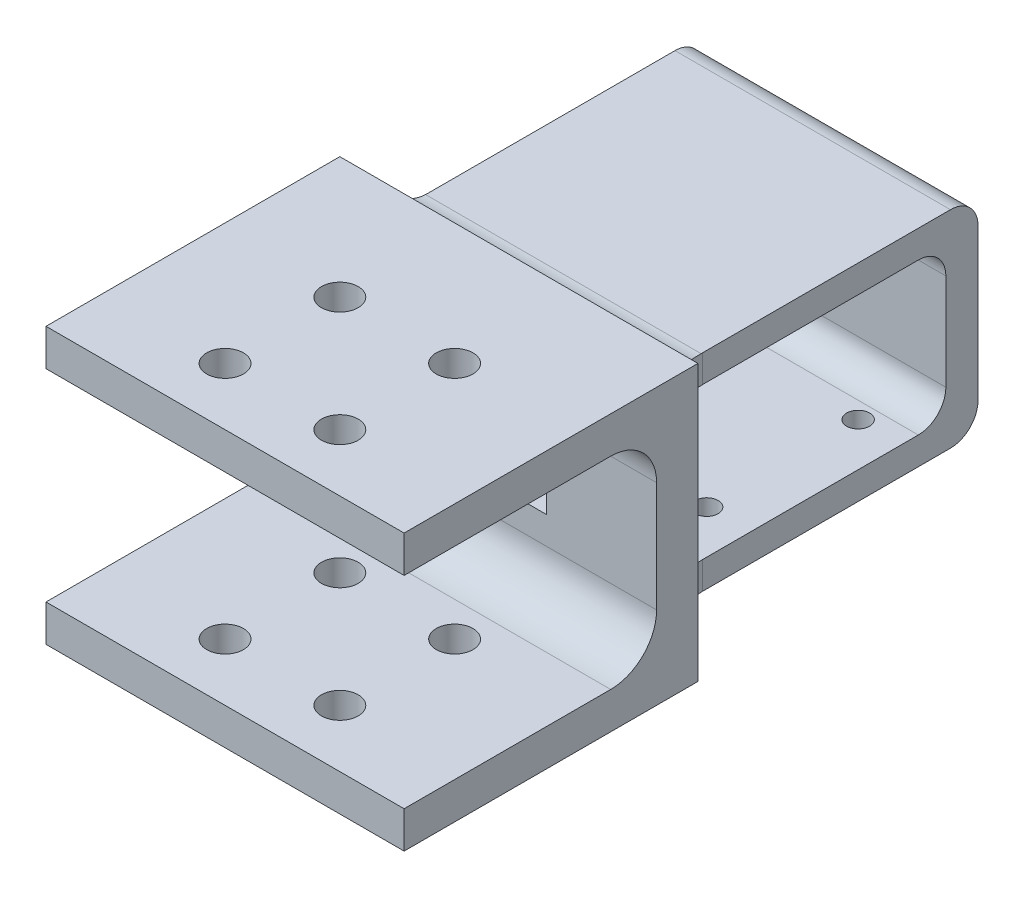
from build123d import *

# Parameters (mm, degrees)
BOSS_EXTRUDE1_DEPTH            = 40
CUT_EXTRUDE4_DEPTH             = 59.523499553598135
FILLET1_R                      = 4
BOSS_EXTRUDE2_DEPTH            = 8
BOSS_EXTRUDE2_DEPTH_BACK       = 10
SKETCH5_R                      = 1.100000000000001
SKETCH5_R_2                    = 1.099999999999999
BOSS_EXTRUDE3_DEPTH            = 2.5
FILLET4_R                      = 0.5
CUT_EXTRUDE5_DEPTH             = 2.5
CUT_EXTRUDE6_REACH             = 57.187
SKETCH7_W                      = 3.0000000000000018
SKETCH7_H                      = 4.5
CUT_EXTRUDE6_DIRECTION_2_REACH = 57.187
SKETCH10_W                     = 42.10000000000001
SKETCH10_H                     = 21.999999999999982
SKETCH10_W_2                   = 33.50000000000001
SKETCH10_H_2                   = 13.600000000000007
BOSS_EXTRUDE5_DEPTH            = 5
FILLET7_R                      = 10
BOSS_EXTRUDE6_DEPTH            = 20
CUT_EXTRUDE7_DEPTH             = 50.000000000000014
CUT_EXTRUDE8_DEPTH             = 1
CUT_EXTRUDE9_DEPTH             = 1
CUT_EXTRUDE10_DEPTH            = 92.39152039439985
SKETCH23_W                     = 3.0000000000000036
SKETCH23_H                     = 3.9999999999999982
SKETCH23_W_2                   = 3
SKETCH23_H_2                   = 3.9999999999999947
BOSS_EXTRUDE7_DEPTH            = 40
SKETCH24_W                     = 36.37597343518531
SKETCH24_H                     = 43.087119181285004
CUT_EXTRUDE13_DEPTH            = 15
SKETCH25_W                     = 34.94503589779944
SKETCH25_H                     = 44.200070599251774
CUT_EXTRUDE14_DEPTH            = 2
BOSS_EXTRUDE8_DEPTH            = 20
BOSS_EXTRUDE8_DEPTH_BACK       = 20
CUT_EXTRUDE15_DEPTH            = 110.35291491313801
SKETCH30_R                     = 1.1999999999999995
SKETCH30_R_2                   = 1.200000000000002
CUT_EXTRUDE16_DEPTH            = 5
SKETCH31_W                     = 19.999999999999993
SKETCH31_H                     = 4.999999999999993
CUT_EXTRUDE17_DEPTH            = 87.29982618754225
CUT_EXTRUDE18_DEPTH            = 76.1509148314244
CUT_EXTRUDE18_DEPTH_BACK       = 10
SKETCH32_R                     = 2
SKETCH35_W                     = 3.256593664037993
SKETCH35_H                     = 33.71989936187824
CUT_EXTRUDE19_DEPTH            = 90.66415114191405
SKETCH36_R                     = 2.0000000000000036
SKETCH36_R_2                   = 2.0000000000000018
BOSS_EXTRUDE9_DEPTH            = 30
SKETCH37_R                     = 2
CUT_EXTRUDE20_DEPTH            = 90.51765189056293
SKETCH38_W                     = 20.75
SKETCH38_H                     = 22.00000000000003
CUT_EXTRUDE21_DEPTH            = 86.51847753555955
SKETCH39_W                     = 72.23047350955149
SKETCH39_H                     = 70.43313668816296
CUT_EXTRUDE22_DEPTH            = 86.51847753555955
BOSS_EXTRUDE10_START           = -39
BOSS_EXTRUDE10_DEPTH           = 39
BOSS_EXTRUDE11_DEPTH           = 10
BOSS_EXTRUDE11_DEPTH_BACK      = 5
BOSS_EXTRUDE12_DEPTH           = 1
BOSS_EXTRUDE12_DEPTH_BACK      = 1
SKETCH42_R                     = 0.9999999999999996
SKETCH42_R_2                   = 1.0000000000000018
BOSS_EXTRUDE13_START           = -5
BOSS_EXTRUDE13_DEPTH           = 15
CUT_EXTRUDE23_DEPTH            = 52.244121614093466
BOSS_EXTRUDE15_START           = -0.5
BOSS_EXTRUDE15_DEPTH           = 2
SKETCH46_W                     = 15.000000000000005
SKETCH46_H                     = 10.749999999999996
BOSS_EXTRUDE16_DEPTH           = 1.45
BOSS_EXTRUDE17_DEPTH           = 1.45
SKETCH48_W                     = 36.4
SKETCH48_H                     = 40.100000000000016
CUT_EXTRUDE24_DEPTH            = 59.957357471311425
SKETCH49_W                     = 38.99999999999999
SKETCH49_H                     = 12.000000000000005
CUT_EXTRUDE25_DEPTH            = 41.709335538669755
BOSS_EXTRUDE18_DEPTH           = 12
BOSS_EXTRUDE19_DEPTH           = 35
SKETCH52_W                     = 3.4999999999999964
SKETCH52_H                     = 22.5
BOSS_EXTRUDE20_DEPTH           = 30
FILLET8_R                      = 3
FILLET9_R                      = 3
CUT_EXTRUDE26_DEPTH            = 4.5
FILLET10_R                     = 5
SKETCH54_R                     = 1.2499999999999973
SKETCH54_R_2                   = 1.2499999999999978
CUT_EXTRUDE27_DEPTH            = 3


with BuildPart() as part:
    # Sketch2 → Boss-Extrude1 (new body)
    with BuildSketch(Plane.XY):
        Polygon((-20.000000000000004, 15), (19.999999999999996, 15), (20.000000000000004, -15), (-20, -15), align=None)
    extrude(amount=BOSS_EXTRUDE1_DEPTH)

    # Sketch3 → Cut-Extrude4 (cut, through all)
    with BuildSketch(Plane.ZY.offset(20.000000000000004)):
        with BuildLine():
            Line((9.500000000000002, 11), (40, 11.000000000000005))
            Line((40, 11.000000000000005), (40, -10.999999999999995))
            Line((40, -10.999999999999995), (9.500000000000002, -11))
            ThreePointArc((9.500000000000002, -11), (5.964466094067265, -9.535533905932738), (4.500000000000003, -6.000000000000002))
            Line((4.500000000000003, -6.000000000000002), (4.500000000000003, 6.000000000000002))
            ThreePointArc((4.500000000000003, 6.000000000000002), (5.964466094067265, 9.535533905932738), (9.500000000000002, 11))
        make_face()
    extrude(amount=-CUT_EXTRUDE4_DEPTH, mode=Mode.SUBTRACT)

    # Fillet1
    fillet1_edges = [part.edges().sort_by_distance(p)[0] for p in [
        (3.55e-15, -15, 0),
        (-3.55e-15, 15, 0),
    ]]
    fillet(fillet1_edges, radius=FILLET1_R)

    # Sketch4 → Boss-Extrude2 (add, two sides: drawn at the far end of the back side and taken through both)
    with BuildSketch(Plane.ZY.offset(10.000000000000002).offset(-BOSS_EXTRUDE2_DEPTH_BACK)):
        Polygon((2.2e-16, 10.999999999999993), (-42.10000000000001, 10.999999999999982), (-42.10000000000001, -11.00000000000002), (1.4175884177630464, -11.000000000000005), (1.4175884177630464, 10.999999999999995), align=None)
        Polygon((-4.999999999999997, -6.099999999999999), (-37.1, -6.100000000000008), (-37.099999999999994, 6.099999999999992), (-4.999999999999999, 6.1), align=None, mode=Mode.SUBTRACT)
    extrude(amount=BOSS_EXTRUDE2_DEPTH + BOSS_EXTRUDE2_DEPTH_BACK)

    # Sketch5 → Boss-Extrude3 (add)
    # profile 1 of 2: a face of its own
    with BuildSketch(Plane(origin=(-2.5000000000000018, -3.9e-16, 0), x_dir=(0, 0, -1), z_dir=(1, 1.6e-16, 0))):
        Polygon((4.999999999999999, 6.1), (9.200000000000001, 6.1), (9.200000000000001, -6.1000000000000085), (4.999999999999999, -6.100000000000001), align=None)
        with Locations(Location((7.249999999999995, -5.23e-15, 0), (0, 0, 90))):
            Circle(SKETCH5_R, mode=Mode.SUBTRACT)
    # profile 2 of 2: a face of its own
    with BuildSketch(Plane(origin=(-2.5000000000000018, -3.9e-16, 0), x_dir=(0, 0, -1), z_dir=(1, 1.6e-16, 0))):
        Polygon((32.9, 6.1), (32.9, -6.1000000000000085), (37.1, -6.100000000000001), (37.1, 6.1), align=None)
        with Locations(Location((34.85, -1.85e-15, 0), (0, 0, 270))):
            Circle(SKETCH5_R_2, mode=Mode.SUBTRACT)
    extrude(amount=-BOSS_EXTRUDE3_DEPTH)

    # Fillet4
    fillet4_edges = [part.edges().sort_by_distance(p)[0] for p in [
        (-5.000000000000002, -1.68e-15, -37.1),
        (-5.000000000000002, -1.68e-15, -4.999999999999999),
    ]]
    fillet(fillet4_edges, radius=FILLET4_R)

    # Sketch6 → Cut-Extrude5 (cut)
    with BuildSketch(Plane(origin=(0, 0, 0), x_dir=(0, 0, -1), z_dir=(1, 1.6e-16, 0))):
        Polygon((37.8, -6.800000000000008), (37.79999999999999, 6.799999999999992), (4.299999999999999, 6.8), (4.299999999999997, -6.799999999999999), align=None)
    extrude(amount=-CUT_EXTRUDE5_DEPTH, mode=Mode.SUBTRACT)

    # Cut-Extrude6: up to this face of the body (flat: up to its plane)
    cut_extrude6_end = Plane(part.part.faces().sort_by_distance((0, 0, 4.5))[0])
    # Sketch7 → Cut-Extrude6 (cut, up to the picked face)
    with BuildSketch(Plane(origin=(0, 0, -9.200000000000001), x_dir=(-1, 0, 0), z_dir=(0, 0, -1)), mode=Mode.PRIVATE) as cut_extrude6_sk1:
        with Locations((13.5, 0)):
            Rectangle(SKETCH7_W, SKETCH7_H)
    cut_extrude6_tool1 = split(extrude(cut_extrude6_sk1.sketch, amount=-CUT_EXTRUDE6_REACH, mode=Mode.PRIVATE), bisect_by=cut_extrude6_end, keep=Keep.BOTH, mode=Mode.PRIVATE)
    add(cut_extrude6_tool1.solids().sort_by(Axis((-13.5, 0, -9.2), (0, 0, 1)))[0], mode=Mode.SUBTRACT)

    # Cut-Extrude6 direction 2: up to this face of the body (flat: up to its plane)
    cut_extrude6_direction_2_end = Plane(part.part.faces().sort_by_distance((-9, 0, -42.1))[0])
    # Sketch7 → Cut-Extrude6 direction 2 (cut, up to the picked face)
    with BuildSketch(Plane(origin=(0, 0, -9.200000000000001), x_dir=(-1, 0, 0), z_dir=(0, 0, -1)), mode=Mode.PRIVATE) as cut_extrude6_direction_2_sk1:
        with Locations((13.5, 0)):
            Rectangle(SKETCH7_W, SKETCH7_H)
    cut_extrude6_direction_2_tool1 = split(extrude(cut_extrude6_direction_2_sk1.sketch, amount=CUT_EXTRUDE6_DIRECTION_2_REACH, mode=Mode.PRIVATE), bisect_by=cut_extrude6_direction_2_end, keep=Keep.BOTH, mode=Mode.PRIVATE)
    add(cut_extrude6_direction_2_tool1.solids().sort_by(Axis((-13.5, 0, -9.2), (0, 0, -1)))[0], mode=Mode.SUBTRACT)

    # Sketch10 → Boss-Extrude5 (add)
    with BuildSketch(Plane(origin=(0, 0, 0), x_dir=(0, 0, -1), z_dir=(1, 1.6e-16, 0))):
        with Locations((21.050000000000004, -8.88e-15)):
            Rectangle(SKETCH10_W, SKETCH10_H)
        with Locations((21.05, -4.44e-15)):
            Rectangle(SKETCH10_W_2, SKETCH10_H_2, mode=Mode.SUBTRACT)
    extrude(amount=BOSS_EXTRUDE5_DEPTH)

    # Fillet7
    fillet7_edges = [part.edges().sort_by_distance(p)[0] for p in [
        (-6.5, 10.99999999999999, -2.2e-16),
        (-6.499999999999998, -11.000000000000002, -2.2e-16),
    ]]
    fillet(fillet7_edges, radius=FILLET7_R)

    # Sketch11 → Boss-Extrude6 (add)
    with BuildSketch(Plane(origin=(0, 0, -42.10000000000001), x_dir=(-1, 0, 0), z_dir=(0, 0, -1))):
        Polygon((1.999999999999995, 10.99999999999999), (-7.999999999999998, 10.99999999999999), (-7.999999999999991, -49.000000000000014), (2.0000000000000124, -49.000000000000014), (18.000000000000014, -49.000000000000014), (18.000000000000004, 10.999999999999979), align=None)
        Polygon((15, 2.25), (15, -2.25), (12, -2.25), (12, 2.2500000000000004), align=None, mode=Mode.SUBTRACT)
    extrude(amount=BOSS_EXTRUDE6_DEPTH)

    # Sketch14 → Cut-Extrude7 (cut)
    with BuildSketch(Plane(origin=(-1.27e-15, 10.999999999999993, -2.72e-15), x_dir=(1, 1.2e-16, 0), z_dir=(-1.2e-16, 1, -2.5e-16))):
        Polygon((1.9999999999999996, 55.1), (3.0000000000000004, 55.1), (3, 53.10000000000001), (13.000000000000002, 53.10000000000001), (13.000000000000002, 51.10000000000001), (3, 51.10000000000001), (3.0000000000000004, 49.1), (-0.9999999999999993, 49.1), (-1, 55.1), (0, 55.1), (-1.73e-15, 65.10000000000001), (1.9999999999999982, 65.10000000000001), align=None)
    extrude(amount=-CUT_EXTRUDE7_DEPTH, mode=Mode.SUBTRACT)

    # Sketch17 → Cut-Extrude8 (cut)
    with BuildSketch(Plane(origin=(0, -39.000000000000036, 0), x_dir=(1, 0, 0), z_dir=(0, 1, 0))):
        Polygon((-1.0000000000000013, 55.1), (2.9999999999999987, 55.1), (2.999999999999999, 49.1), (-1.0000000000000002, 49.1), align=None)
    extrude(amount=-CUT_EXTRUDE8_DEPTH, mode=Mode.SUBTRACT)

    # Sketch18 → Cut-Extrude9 (cut)
    with BuildSketch(Plane(origin=(-1.27e-15, 10.999999999999993, -2.72e-15), x_dir=(1, 1.2e-16, 0), z_dir=(-1.2e-16, 1, -2.5e-16))):
        Polygon((-17, 61.1), (6.999999999999999, 61.1), (6.999999999999999, 43.10000000000001), (-16.999999999999996, 43.10000000000001), align=None)
    extrude(amount=-CUT_EXTRUDE9_DEPTH, mode=Mode.SUBTRACT)

    # Sketch20 → Cut-Extrude10 (cut, through all)
    with BuildSketch(Plane(origin=(0, 15, 0), x_dir=(1, 0, 0), z_dir=(0, 1, 0))):
        Polygon((-23.277248853240756, -28.999999999999996), (21.563064344709886, -28.999999999999996), (21.563064344709886, -45.223630905791175), (-23.277248853240753, -45.223630905791175), align=None)
    extrude(amount=-CUT_EXTRUDE10_DEPTH, mode=Mode.SUBTRACT)

    # Sketch23 → Boss-Extrude7 (add)
    with BuildSketch(Plane.ZY.offset(20.000000000000004)):
        with Locations((30.5, 13.000000000000004)):
            Rectangle(SKETCH23_W, SKETCH23_H)
        with Locations((30.499999999999986, -13)):
            Rectangle(SKETCH23_W_2, SKETCH23_H_2)
    extrude(amount=-BOSS_EXTRUDE7_DEPTH)

    # Sketch24 → Cut-Extrude13 (cut)
    with BuildSketch(Plane(origin=(20, 4.63e-15, 0), x_dir=(0, 0, -1), z_dir=(1, 2.3e-16, 0))):
        with Locations((-18.187986717592654, 1.3612837109291025)):
            Rectangle(SKETCH24_W, SKETCH24_H)
    extrude(amount=-CUT_EXTRUDE13_DEPTH, mode=Mode.SUBTRACT)

    # Sketch25 → Cut-Extrude14 (cut)
    with BuildSketch(Plane.ZY.offset(20.000000000000004)):
        with Locations((17.47251794889972, 0.47340924827550346)):
            Rectangle(SKETCH25_W, SKETCH25_H)
    extrude(amount=-CUT_EXTRUDE14_DEPTH, mode=Mode.SUBTRACT)

    # Sketch26 → Boss-Extrude8 (add, two sides: drawn at the far end of the back side and taken through both)
    with BuildSketch(Plane.ZY.offset(6.500000000000001).offset(-BOSS_EXTRUDE8_DEPTH_BACK)):
        with BuildLine():
            Line((1.2005831511049319, 13.857142857142856), (1.2005831511049383, -13.857142857142856))
            ThreePointArc((1.2005831511049383, -13.857142857142856), (2.488142107963088, -14.703280399090202), (3.9999999999999956, -14.999999999999996))
            Line((3.9999999999999956, -14.999999999999996), (31.999999999999986, -14.999999999999996))
            Line((31.999999999999986, -14.999999999999996), (31.999999999999986, -10.999999999999998))
            Line((31.999999999999986, -10.999999999999998), (9.500000000000002, -10.999999999999998))
            ThreePointArc((9.500000000000002, -10.999999999999998), (5.964466094067264, -9.535533905932738), (4.5000000000000036, -6))
            Line((4.5000000000000036, -6), (4.500000000000003, 6.000000000000003))
            ThreePointArc((4.500000000000003, 6.000000000000003), (5.964466094067265, 9.535533905932738), (9.500000000000002, 11))
            Line((9.500000000000002, 11), (32, 11.000000000000005))
            Line((32, 11.000000000000005), (32, 15.000000000000007))
            Line((32, 15.000000000000007), (3.9999999999999964, 15.000000000000004))
            ThreePointArc((3.9999999999999964, 15.000000000000004), (2.4881421079630845, 14.703280399090207), (1.2005831511049319, 13.857142857142856))
        make_face()
    extrude(amount=BOSS_EXTRUDE8_DEPTH + BOSS_EXTRUDE8_DEPTH_BACK)

    # Sketch27 → Cut-Extrude15 (cut, through all)
    with BuildSketch(Plane(origin=(0, 0, -62.1), x_dir=(-1, 0, 0), z_dir=(0, 0, -1))):
        Polygon((12, -2.2500000000000004), (15, -2.25), (15, 2.25), (12, 2.25), align=None)
    extrude(amount=-CUT_EXTRUDE15_DEPTH, mode=Mode.SUBTRACT)

    # Sketch30 → Cut-Extrude16 (cut)
    with BuildSketch(Plane(origin=(-7.2e-16, 9.999999999999995, -2.89e-15), x_dir=(1, 7e-17, 0), z_dir=(-7e-17, 1, -2.9e-16))):
        with Locations(Location((4.999999999999999, 58.1, 0), (0, 0, 270))):
            Circle(SKETCH30_R)
        with Locations(Location((4.999999999999999, 46.100000000000016, 0), (0, 0, 90))):
            Circle(SKETCH30_R)
        with Locations(Location((-14.999999999999998, 58.1, 0), (0, 0, 90))):
            Circle(SKETCH30_R_2)
        with Locations(Location((-14.999999999999998, 46.100000000000016, 0), (0, 0, 270))):
            Circle(SKETCH30_R_2)
    extrude(amount=-CUT_EXTRUDE16_DEPTH, mode=Mode.SUBTRACT)

    # Sketch31 → Cut-Extrude17 (cut, through all)
    with BuildSketch(Plane(origin=(7.9999999999999964, -9.3e-16, 0), x_dir=(0, 0, -1), z_dir=(1, -1.2e-16, 0))):
        with Locations((52.10000000000001, -46.500000000000014)):
            Rectangle(SKETCH31_W, SKETCH31_H)
    extrude(amount=-CUT_EXTRUDE17_DEPTH, mode=Mode.SUBTRACT)

    # Sketch32 → Cut-Extrude18 (cut, two sides: drawn at the far end of the back side and taken through both)
    with BuildSketch(Plane(origin=(1.27e-15, -11, 1.88e-15), x_dir=(1, 1.2e-16, 0), z_dir=(-1.2e-16, 1, -1.7e-16)).offset(-CUT_EXTRUDE18_DEPTH_BACK)):
        with Locations(Location((-16.5, -26.37499999999999, 0), (0, 0, 90))):
            Circle(SKETCH32_R)
        with Locations(Location((-16.500000000000004, -15.124999999999996, 0), (0, 0, 90))):
            Circle(SKETCH32_R)
        with Locations(Location((3.4999999999999996, -26.37499999999999, 0), (0, 0, 90))):
            Circle(SKETCH32_R)
        with Locations(Location((3.500000000000003, -15.124999999999996, 0), (0, 0, 90))):
            Circle(SKETCH32_R)
    extrude(amount=CUT_EXTRUDE18_DEPTH + CUT_EXTRUDE18_DEPTH_BACK, mode=Mode.SUBTRACT)

    # Sketch35 → Cut-Extrude19 (cut, through all)
    with BuildSketch(Plane(origin=(0, 15, 0), x_dir=(1, 0, 0), z_dir=(0, 1, 0))):
        with Locations((14.628296832018993, -16.85994968093912)):
            Rectangle(SKETCH35_W, SKETCH35_H)
        with Locations((-27.628296832019, -16.85994968093912)):
            Rectangle(SKETCH35_W, SKETCH35_H)
    extrude(amount=-CUT_EXTRUDE19_DEPTH, mode=Mode.SUBTRACT)

    # Sketch36 → Boss-Extrude9 (add)
    with BuildSketch(Plane(origin=(0, 15, 0), x_dir=(1, 0, 0), z_dir=(0, 1, 0))):
        with Locations(Location((-16.500000000000007, -15.124999999999993, 0), (0, 0, 270))):
            Circle(SKETCH36_R)
        with Locations(Location((3.5000000000000013, -15.124999999999993, 0), (0, 0, 270))):
            Circle(SKETCH36_R)
        with Locations(Location((3.499999999999998, -26.37499999999999, 0), (0, 0, 270))):
            Circle(SKETCH36_R)
        with Locations(Location((-16.500000000000004, -26.37499999999999, 0), (0, 0, 270))):
            Circle(SKETCH36_R_2)
    extrude(amount=-BOSS_EXTRUDE9_DEPTH)

    # Sketch37 → Cut-Extrude20 (cut, through all)
    with BuildSketch(Plane(origin=(0, 15, 0), x_dir=(1, 0, 0), z_dir=(0, 1, 0))):
        with Locations(Location((-12.750000000000002, -25.750000000000004, 0), (0, 0, 270))):
            Circle(SKETCH37_R)
        with Locations(Location((-0.25000000000000194, -25.750000000000004, 0), (0, 0, 270))):
            Circle(SKETCH37_R)
        with Locations(Location((-0.25000000000000194, -13.249999999999998, 0), (0, 0, 270))):
            Circle(SKETCH37_R)
        with Locations(Location((-12.750000000000002, -13.249999999999998, 0), (0, 0, 270))):
            Circle(SKETCH37_R)
    extrude(amount=-CUT_EXTRUDE20_DEPTH, mode=Mode.SUBTRACT)

    # Sketch38 → Cut-Extrude21 (cut, through all)
    with BuildSketch(Plane(origin=(12.999999999999995, 0, 0), x_dir=(0, 0, -1), z_dir=(1, 0, 0))):
        with Locations((-21.625, -7.99e-15)):
            Rectangle(SKETCH38_W, SKETCH38_H)
    extrude(amount=-CUT_EXTRUDE21_DEPTH, mode=Mode.SUBTRACT)

    # Sketch39 → Cut-Extrude22 (cut, through all)
    with BuildSketch(Plane(origin=(12.999999999999995, 0, 0), x_dir=(0, 0, -1), z_dir=(1, 0, 0))):
        with Locations((33.86442471014106, -15.892395865001207)):
            Rectangle(SKETCH39_W, SKETCH39_H)
    extrude(amount=-CUT_EXTRUDE22_DEPTH, mode=Mode.SUBTRACT)

    # Sketch40 → Boss-Extrude10 (add)
    with BuildSketch(Plane(origin=(12.999999999999995, 0, 0), x_dir=(0, 0, -1), z_dir=(1, 0, 0)).offset(BOSS_EXTRUDE10_START)):
        Polygon((-3.9999999999999964, 15), (0, 15), (3.69e-15, -14.999999999999998), (-3.9999999999999964, -15), align=None)
    extrude(amount=BOSS_EXTRUDE10_DEPTH)

    # Sketch41 → Boss-Extrude11 (add, two sides: drawn at the far end of the back side and taken through both)
    with BuildSketch(Plane.ZY.offset(6.500000000000003).offset(-BOSS_EXTRUDE11_DEPTH_BACK)):
        Polygon((-21.400000000000002, 15), (-3.000000000000001, 15), (0, 15), (1.5470726612208523, 15), (1.5470726612208523, -14.999999999999998), (-3.69e-15, -14.999999999999998), (-2.999999999999997, -15), (-2.9999999999999956, -23.60000000000001), (-21.4, -23.60000000000001), align=None)
        Polygon((-18.400000000000006, 12), (-6.000000000000002, 12), (-5.999999999999996, -20.600000000000012), (-18.399999999999995, -20.600000000000016), align=None, mode=Mode.SUBTRACT)
    extrude(amount=BOSS_EXTRUDE11_DEPTH + BOSS_EXTRUDE11_DEPTH_BACK)

    # Sketch42 → Boss-Extrude12 (add, two sides: drawn at the far end of the back side and taken through both)
    # profile 1 of 2: a face of its own
    with BuildSketch(Plane.ZY.offset(6.500000000000003).offset(-BOSS_EXTRUDE12_DEPTH_BACK)):
        Polygon((-18.400000000000006, 12), (-6.000000000000001, 12), (-5.999999999999996, 8), (-18.400000000000006, 8), align=None)
        with Locations((-12.200000000000005, 9.499999999999998)):
            Circle(SKETCH42_R, mode=Mode.SUBTRACT)
    # profile 2 of 2: a face of its own
    with BuildSketch(Plane.ZY.offset(6.500000000000003).offset(-BOSS_EXTRUDE12_DEPTH_BACK)):
        Polygon((-5.99999999999999, -20.600000000000012), (-5.9999999999999885, -16.600000000000012), (-18.4, -16.60000000000002), (-18.399999999999995, -20.60000000000002), align=None)
        with Locations(Location((-12.199999999999998, -18.100000000000012, 0), (0, 0, 180))):
            Circle(SKETCH42_R_2, mode=Mode.SUBTRACT)
    extrude(amount=BOSS_EXTRUDE12_DEPTH + BOSS_EXTRUDE12_DEPTH_BACK)

    # Sketch43 → Boss-Extrude13 (add)
    with BuildSketch(Plane.ZY.offset(6.500000000000003).offset(BOSS_EXTRUDE13_START)):
        Polygon((-21.4, -23.60000000000001), (-36.4, -23.600000000000012), (-36.4, 1.3999999999999881), (-21.4, 1.3999999999999924), align=None)
    extrude(amount=BOSS_EXTRUDE13_DEPTH)

    # Sketch44 → Cut-Extrude23 (cut, through all)
    with BuildSketch(Plane(origin=(0, 1.3999999999999986, -4e-16), x_dir=(1, 0, 0), z_dir=(0, 1, -2.9e-16))):
        Polygon((-11.000000000000002, 33.9), (-10.05161980261447, 33.9), (-10.05161980261447, 38.21704707254863), (-7.988963640274769, 38.21704707254863), (-7.988963640274769, 33.9), (-7.000000000000001, 33.9), (-7.000000000000001, 31.9), (0.8667068167036787, 31.9), (0.8667068167036787, 29.900000000000006), (-7.000000000000001, 29.900000000000006), (-6.999999999999999, 27.900000000000002), (-11.000000000000002, 27.900000000000002), (-11.000000000000007, 29.900000000000002), (-18.866706816703683, 29.900000000000002), (-18.866706816703683, 31.89999999999999), (-11.000000000000007, 31.9), align=None)
    extrude(amount=-CUT_EXTRUDE23_DEPTH, mode=Mode.SUBTRACT)


with BuildPart() as cut_extrude23_piece_1:
    # of the separate pieces the step leaves, piece 1, a body of its own (cut_extrude23_pieces)
    add(part.part.solids().sort_by_distance((13, 15, 0))[0])



with BuildPart() as cut_extrude23_piece_2:
    # of the separate pieces the step leaves, piece 2, a body of its own (cut_extrude23_pieces)
    add(part.part.solids().sort_by_distance((-1.5, 1.4, -36.4))[0])


with BuildPart() as cut_extrude23_piece_3:
    # of the separate pieces the step leaves, piece 3, a body of its own (cut_extrude23_pieces)
    add(part.part.solids().sort_by_distance((-16.5, 1.4, -36.4))[0])


with BuildPart() as cut_extrude23_piece_1_1:
    add(cut_extrude23_piece_1.part)

    add(cut_extrude23_piece_2.part)  # Boss-Extrude15 merges Cut-Extrude23 piece 2

    add(cut_extrude23_piece_3.part)  # Boss-Extrude15 merges Cut-Extrude23 piece 3
    # Sketch45 → Boss-Extrude15 (add)
    with BuildSketch(Plane(origin=(0, 1.3999999999999986, -4e-16), x_dir=(1, 0, 0), z_dir=(0, 1, -2.9e-16)).offset(BOSS_EXTRUDE15_START)):
        Polygon((-11.000000000000002, 33.9), (-10.05161980261447, 33.9), (-9.851619802614469, 33.9), (-9.851619802614469, 36.4), (-8.18896364027477, 36.4), (-8.18896364027477, 33.9), (-7.988963640274769, 33.9), (-6.999999999999999, 33.9), (-7.000000000000001, 31.9), (-7.000000000000001, 31.7), (-1.5000000000000013, 31.7), (-1.5000000000000013, 30.100000000000005), (-7.000000000000003, 30.100000000000005), (-7.000000000000003, 29.900000000000006), (-6.999999999999999, 27.900000000000002), (-11.000000000000002, 27.900000000000002), (-11.000000000000007, 29.900000000000002), (-11.000000000000007, 30.1), (-16.50000000000001, 30.1), (-16.500000000000007, 31.7), (-11.000000000000007, 31.7), (-11.000000000000007, 31.9), align=None)
    boss_extrude15 = extrude(amount=BOSS_EXTRUDE15_DEPTH)

    # Sketch46 → Boss-Extrude16 (add)
    with BuildSketch(Plane(origin=(0, 2.8999999999999964, -6.3e-16), x_dir=(1, 0, 0), z_dir=(0, 1, -2.2e-16))):
        with Locations((-9.000000000000004, 31.025)):
            Rectangle(SKETCH46_W, SKETCH46_H)
    extrude(amount=-BOSS_EXTRUDE16_DEPTH)

    # Mirror1: Boss-Extrude15 across plane
    add(boss_extrude15.mirror(Plane.ZX.offset(-11.100000000000005)))

    # Sketch47 → Boss-Extrude17 (add)
    with BuildSketch(Plane.XZ.offset(25.10000000000001)):
        Polygon((-1.5000000000000013, -36.4), (-16.5, -36.4), (-16.5, -25.650000000000002), (-1.5000000000000013, -25.65), align=None)
    extrude(amount=-BOSS_EXTRUDE17_DEPTH)

    # Sketch48 → Cut-Extrude24 (cut, through all)
    with BuildSketch(Plane(origin=(12.999999999999995, 0, 0), x_dir=(0, 0, -1), z_dir=(1, 0, 0))):
        with Locations((18.2, -5.050000000000005)):
            Rectangle(SKETCH48_W, SKETCH48_H)
    extrude(amount=-CUT_EXTRUDE24_DEPTH, mode=Mode.SUBTRACT)

    # Sketch49 → Cut-Extrude25 (cut, through all)
    with BuildSketch(Plane.XY.offset(4.500000000000003)):
        with Locations((-6.5, 2.66e-15)):
            Rectangle(SKETCH49_W, SKETCH49_H)
    extrude(amount=-CUT_EXTRUDE25_DEPTH, mode=Mode.SUBTRACT)


with BuildPart() as cut_extrude25_piece_1:
    # of the separate pieces the step leaves, piece 1, a body of its own (cut_extrude25_pieces)
    add(cut_extrude23_piece_1_1.part.solids().sort_by_distance((13, 15, 0))[0])



with BuildPart() as cut_extrude25_piece_2:
    # of the separate pieces the step leaves, piece 2, a body of its own (cut_extrude25_pieces)
    add(cut_extrude23_piece_1_1.part.solids().sort_by_distance((13, -6, 0))[0])


with BuildPart() as cut_extrude25_piece_1_1:
    add(cut_extrude25_piece_1.part)

    add(cut_extrude25_piece_2.part)  # Boss-Extrude18 merges Cut-Extrude25 piece 2
    # Sketch50 → Boss-Extrude18 (add)
    with BuildSketch(Plane(origin=(0, -6.000000000000001, 0), x_dir=(1, 0, 0), z_dir=(0, 1, 0))):
        Polygon((-25.999999999999996, -4.500000000000003), (12.999999999999995, -4.5000000000000036), (12.999999999999995, 3.47e-15), (-25.999999999999996, 3.47e-15), align=None)
    extrude(amount=BOSS_EXTRUDE18_DEPTH)

    # Sketch51 → Boss-Extrude19 (add)
    with BuildSketch(Plane(origin=(0, 0, 0), x_dir=(-1, 0, 0), z_dir=(0, 1.2e-16, -1))):
        Polygon((-8.5, 8.25), (21.5, 8.25), (21.500000000000004, 11.250000000000005), (-8.499999999999996, 11.250000000000005), align=None)
        Polygon((-8.499999999999993, -11.249999999999995), (21.50000000000001, -11.249999999999995), (21.5, -8.25), (-8.5, -8.25), align=None)
    extrude(amount=BOSS_EXTRUDE19_DEPTH)

    # Sketch52 → Boss-Extrude20 (add)
    with BuildSketch(Plane(origin=(8.500000000000009, 9.83e-15, 0), x_dir=(0, 0, -1), z_dir=(1, 1.16e-15, 0))):
        with Locations((33.25, -1.78e-15)):
            Rectangle(SKETCH52_W, SKETCH52_H)
    extrude(amount=-BOSS_EXTRUDE20_DEPTH)

    # Fillet8
    fillet8_edges = [cut_extrude25_piece_1_1.edges().sort_by_distance(p)[0] for p in [
        (-6.500000000000009, -11.249999999999991, -35),
        (-6.5000000000000036, 11.250000000000009, -35),
    ]]
    fillet(fillet8_edges, radius=FILLET8_R)

    # Fillet9
    fillet9_edges = [cut_extrude25_piece_1_1.edges().sort_by_distance(p)[0] for p in [
        (-6.499999999999993, -8.249999999999996, -31.5),
        (-6.500000000000002, 8.250000000000004, -31.5),
    ]]
    fillet(fillet9_edges, radius=FILLET9_R)

    # Sketch53 → Cut-Extrude26 (cut)
    with BuildSketch(Plane.XY.offset(4.5000000000000036)):
        Polygon((-13.999999999999998, 3.0000000000000053), (1, 3.0000000000000053), (1.0000000000000004, -2.9999999999999947), (-13.999999999999996, -2.9999999999999947), align=None)
    extrude(amount=-CUT_EXTRUDE26_DEPTH, mode=Mode.SUBTRACT)

    # Fillet10
    # the kernel refuses this fillet: 5 mm, written as the material it adds along each edge
    with BuildSketch(Plane(origin=(-21.50000000000001, -11.249999999999995, -1.38e-15), x_dir=(-1, 3.55e-15, -4.8e-16), z_dir=(3.55e-15, 1, 1.2e-16))) as fillet10_piece_1:
        with BuildLine():
            CenterArc((4.999999999999971, -4.9749371855331015), FILLET10_R, 95.73917047726648, 84.26082952273356)
            Line((-2.958e-14, -4.974937185533104), (-0.100000000000031, -4.974937185533104))
            Line((-0.100000000000031, -4.974937185533104), (-0.10000000000000142, -5e-17))
            Line((-0.10000000000000142, -5e-17), (-5e-17, 0.1))
            ThreePointArc((-5e-17, 0.1), (2.2499999999999964, 0.09999999999999926), (4.489999999999998, 0.09949874371066206))
            Line((4.489999999999998, 0.09949874371066206), (4.4999999999999964, 0))
        make_face()
    extrude(amount=2.9999999999999947)
    with BuildSketch(Plane(origin=(8.5, -8.25, -1.01e-15), x_dir=(3.93e-15, 1.2e-16, -1), z_dir=(-2.37e-15, -1, -1.2e-16))) as fillet10_piece_2:
        with BuildLine():
            CenterArc((4.974937185533118, 5), FILLET10_R, 185.73917047726684, 84.26082952273293)
            Line((1.933e-14, 4.499999999999995), (-0.09949874371064266, 4.489999999999995))
            ThreePointArc((-0.09949874371064266, 4.489999999999995), (-0.09999999999998932, 2.2499999999999933), (-0.1, 3.9e-16))
            Line((-0.1, 3.9e-16), (-3.9e-16, -0.09999999999999964))
            Line((-3.9e-16, -0.09999999999999964), (4.974937185533099, -0.09999999999999964))
            Line((4.974937185533099, -0.09999999999999964), (4.974937185533099, 0))
        make_face()
    extrude(amount=2.9999999999999947)
    with BuildSketch(Plane(origin=(8.499999999999993, -11.249999999999995, -1.38e-15), x_dir=(0, -1, -5.8e-16), z_dir=(-1, 0, 0))) as fillet10_piece_3:
        with BuildLine():
            CenterArc((5.000000000000001, -4.841229182759271), FILLET10_R, 104.4775121859299, 75.52248781407013)
            Line((1.03e-15, -4.841229182759273), (-0.09999999999999862, -4.841229182759273))
            Line((-0.09999999999999862, -4.841229182759273), (-0.09999999999999964, -5e-17))
            Line((-0.09999999999999964, -5e-17), (-6e-17, 0.1))
            ThreePointArc((-6e-17, 0.1), (1.8750000000000018, 0.09999999999999902), (3.725000000000003, 0.09682458365518543))
            Line((3.725000000000003, 0.09682458365518543), (3.7500000000000036, 0))
        make_face()
    extrude(amount=30.000000000000004)
    with BuildSketch(Plane(origin=(8.499999999999996, 11.250000000000005, 1.38e-15), x_dir=(0, 1.2e-16, -1), z_dir=(1.18e-15, -1, -1.2e-16))) as fillet10_piece_4:
        with BuildLine():
            CenterArc((4.974937185533102, 5), FILLET10_R, 185.7391704772668, 84.26082952273316)
            Line((2.27e-15, 4.499999999999998), (-0.09949874371065973, 4.489999999999998))
            ThreePointArc((-0.09949874371065973, 4.489999999999998), (-0.09999999999999816, 2.2499999999999964), (-0.1, 0))
            Line((-0.1, 0), (0, -0.09999999999999964))
            Line((0, -0.09999999999999964), (4.974937185533102, -0.09999999999999964))
            Line((4.974937185533102, -0.09999999999999964), (4.974937185533102, 0))
        make_face()
    extrude(amount=3.0000000000000053)
    with BuildSketch(Plane(origin=(-21.5, 8.25, 1.01e-15), x_dir=(-1, -1.18e-15, -4.2e-16), z_dir=(-1.18e-15, 1, 1.2e-16))) as fillet10_piece_5:
        with BuildLine():
            CenterArc((5.000000000000002, -4.974937185533101), FILLET10_R, 95.73917047726673, 84.26082952273327)
            Line((2.1e-15, -4.974937185533102), (-0.09999999999999931, -4.974937185533102))
            Line((-0.09999999999999931, -4.974937185533102), (-0.10000000000000142, -4e-17))
            Line((-0.10000000000000142, -4e-17), (-4e-17, 0.1))
            ThreePointArc((-4e-17, 0.1), (2.2500000000000036, 0.09999999999999912), (4.4900000000000055, 0.09949874371066202))
            Line((4.4900000000000055, 0.09949874371066202), (4.500000000000007, 0))
        make_face()
    extrude(amount=3.0000000000000053)
    with BuildSketch(Plane(origin=(-21.500000000000004, 11.250000000000005, 1.38e-15), x_dir=(0, 1, -3.7e-16), z_dir=(1, 0, 0))) as fillet10_piece_6:
        with BuildLine():
            CenterArc((5.0000000000000036, -4.841229182759269), FILLET10_R, 104.47751218593004, 75.52248781407002)
            Line((3.56e-15, -4.841229182759272), (-0.09999999999999608, -4.841229182759272))
            Line((-0.09999999999999608, -4.841229182759272), (-0.09999999999999964, -5e-17))
            Line((-0.09999999999999964, -5e-17), (-4e-17, 0.1))
            ThreePointArc((-4e-17, 0.1), (1.8749999999999982, 0.09999999999999908), (3.7249999999999943, 0.09682458365518537))
            Line((3.7249999999999943, 0.09682458365518537), (3.7499999999999947, 0))
        make_face()
    extrude(amount=30)
    with BuildSketch(Plane(origin=(8.499999999999993, -11.249999999999995, -1.38e-15), x_dir=(0, -1, -5.8e-16), z_dir=(-1, 0, 0))) as fillet10_piece_7a_section:
        with BuildLine():
            CenterArc((5.000000000000001, -4.841229182759271), FILLET10_R, 104.4775121859299, 75.52248781407013)
            Line((1.03e-15, -4.841229182759273), (-0.09999999999999862, -4.841229182759273))
            Line((-0.09999999999999862, -4.841229182759273), (-0.09999999999999964, -5e-17))
            Line((-0.09999999999999964, -5e-17), (-6e-17, 0.1))
            ThreePointArc((-6e-17, 0.1), (1.8750000000000018, 0.09999999999999902), (3.725000000000003, 0.09682458365518543))
            Line((3.725000000000003, 0.09682458365518543), (3.7500000000000036, 0))
        make_face()
    fillet10_piece_7a = extrude(amount=42.10307295689819, mode=Mode.PRIVATE)
    fillet10_piece_7a = split(fillet10_piece_7a, bisect_by=Plane(origin=(-26, -12.197958778300034, -1.1407205040677426), z_dir=(1, 0, 0)), keep=Keep.TOP, mode=Mode.PRIVATE)
    fillet10_piece_7a = split(fillet10_piece_7a, bisect_by=Plane(origin=(-21.499999999999975, -12.197958778300027, -1.1407205040677424), z_dir=(-1, -1.18e-15, 0)), keep=Keep.TOP, mode=Mode.PRIVATE)
    with BuildSketch(Plane(origin=(-21.49999999999996, -23.687342963832755, -4.75e-15), x_dir=(-1, 3.55e-15, -1.3e-16), z_dir=(3.55e-15, 1, 1.2e-16))) as fillet10_piece_7b_section:
        with BuildLine():
            CenterArc((5.000000000000001, -4.974937185533104), FILLET10_R, 95.73917047726627, 84.26082952273373)
            Line((6.4e-16, -4.974937185533105), (-0.10000000000000078, -4.974937185533105))
            Line((-0.10000000000000078, -4.974937185533105), (-0.10000000000000142, -1e-17))
            Line((-0.10000000000000142, -1e-17), (-1e-17, 0.1))
            ThreePointArc((-1e-17, 0.1), (2.250000000000025, 0.1000000000000003), (4.490000000000048, 0.09949874371066209))
            Line((4.490000000000048, 0.09949874371066209), (4.500000000000046, 0))
        make_face()
    fillet10_piece_7b = extrude(amount=15.437342963832755, mode=Mode.PRIVATE)
    fillet10_piece_7b = split(fillet10_piece_7b, bisect_by=Plane(origin=(-22.581075777788463, -15, -1.1409930335807834), z_dir=(-1.6e-16, 1, 0)), keep=Keep.TOP, mode=Mode.PRIVATE)
    fillet10_piece_7b = split(fillet10_piece_7b, bisect_by=Plane(origin=(-22.58107577778846, -11.249999999999995, -1.140993033580783), z_dir=(0, -1, -1.2e-16)), keep=Keep.TOP, mode=Mode.PRIVATE)
    fillet10_piece_7 = fillet10_piece_7a & fillet10_piece_7b
    add(fillet10_piece_7)
    with BuildSketch(Plane(origin=(8.5, -8.25, -1.01e-15), x_dir=(3.93e-15, 1.2e-16, -1), z_dir=(-2.37e-15, -1, -1.2e-16))) as fillet10_piece_8a_section:
        with BuildLine():
            CenterArc((4.974937185533118, 5), FILLET10_R, 185.73917047726684, 84.26082952273293)
            Line((1.933e-14, 4.499999999999995), (-0.09949874371064266, 4.489999999999995))
            ThreePointArc((-0.09949874371064266, 4.489999999999995), (-0.09999999999998932, 2.2499999999999933), (-0.1, 3.9e-16))
            Line((-0.1, 3.9e-16), (-3.9e-16, -0.09999999999999964))
            Line((-3.9e-16, -0.09999999999999964), (4.974937185533099, -0.09999999999999964))
            Line((4.974937185533099, -0.09999999999999964), (4.974937185533099, 0))
        make_face()
    fillet10_piece_8a = extrude(amount=15.43734296383274, mode=Mode.PRIVATE)
    fillet10_piece_8a = split(fillet10_piece_8a, bisect_by=Plane(origin=(9.581075777790863, -11.249999999999995, -1.140993033579778), z_dir=(0, -1, -1.2e-16)), keep=Keep.TOP, mode=Mode.PRIVATE)
    fillet10_piece_8a = split(fillet10_piece_8a, bisect_by=Plane(origin=(9.581075777790863, -14.999999999999996, -1.140993033579778), z_dir=(-1.6e-16, 1, 0)), keep=Keep.TOP, mode=Mode.PRIVATE)
    with BuildSketch(Plane(origin=(20.603072956898174, -11.249999999999993, -3.23e-15), x_dir=(0, -1, -1.217e-14), z_dir=(-1, 0, 0))) as fillet10_piece_8b_section:
        with BuildLine():
            CenterArc((5.000000000000059, -4.84122918275926), FILLET10_R, 104.47751218593042, 75.52248781407025)
            Line((5.89e-14, -4.84122918275932), (-0.09999999999994075, -4.841229182759321))
            Line((-0.09999999999994075, -4.841229182759321), (-0.09999999999999964, -1.2e-15))
            Line((-0.09999999999999964, -1.2e-15), (-1.22e-15, 0.1))
            ThreePointArc((-1.22e-15, 0.1), (1.875000000000006, 0.10000000000002258), (3.725000000000016, 0.0968245836551852))
            Line((3.725000000000016, 0.0968245836551852), (3.7500000000000178, 0))
        make_face()
    fillet10_piece_8b = extrude(amount=42.10307295689819, mode=Mode.PRIVATE)
    fillet10_piece_8b = split(fillet10_piece_8b, bisect_by=Plane(origin=(8.500000000000025, -12.197958778300036, -1.1407205040677413), z_dir=(1, 1.18e-15, 0)), keep=Keep.TOP, mode=Mode.PRIVATE)
    fillet10_piece_8b = split(fillet10_piece_8b, bisect_by=Plane(origin=(12.999999999999995, -12.197958778300034, -1.1407205040677413), z_dir=(-1, 0, 0)), keep=Keep.TOP, mode=Mode.PRIVATE)
    fillet10_piece_8 = fillet10_piece_8a & fillet10_piece_8b
    add(fillet10_piece_8)
    with BuildSketch(Plane(origin=(8.499999999999982, 23.687342963832755, 1.07e-15), x_dir=(0, 1.2e-16, -1), z_dir=(1.18e-15, -1, -1.2e-16))) as fillet10_piece_9a_section:
        with BuildLine():
            CenterArc((4.974937185533101, 5), FILLET10_R, 185.73917047726664, 84.26082952273339)
            Line((1.8e-16, 4.500000000000012), (-0.09949874371066184, 4.490000000000013))
            ThreePointArc((-0.09949874371066184, 4.490000000000013), (-0.1, 2.2500000000000107), (-0.1, 0))
            Line((-0.1, 0), (0, -0.09999999999999964))
            Line((0, -0.09999999999999964), (4.974937185533101, -0.09999999999999964))
            Line((4.974937185533101, -0.09999999999999964), (4.974937185533101, 0))
        make_face()
    fillet10_piece_9a = extrude(amount=15.437342963832755, mode=Mode.PRIVATE)
    fillet10_piece_9a = split(fillet10_piece_9a, bisect_by=Plane(origin=(9.581075777790833, 11.250000000000005, -1.1409930335814085), z_dir=(0, 1, 1.2e-16)), keep=Keep.TOP, mode=Mode.PRIVATE)
    fillet10_piece_9a = split(fillet10_piece_9a, bisect_by=Plane(origin=(9.58107577779083, 15.000000000000004, -1.1409930335814096), z_dir=(1.6e-16, -1, 1.3e-16)), keep=Keep.TOP, mode=Mode.PRIVATE)
    with BuildSketch(Plane(origin=(-21.500000000000004, 11.250000000000005, 1.38e-15), x_dir=(0, 1, -3.7e-16), z_dir=(1, 0, 0))) as fillet10_piece_9b_section:
        with BuildLine():
            CenterArc((5.0000000000000036, -4.841229182759269), FILLET10_R, 104.47751218593004, 75.52248781407002)
            Line((3.56e-15, -4.841229182759272), (-0.09999999999999608, -4.841229182759272))
            Line((-0.09999999999999608, -4.841229182759272), (-0.09999999999999964, -5e-17))
            Line((-0.09999999999999964, -5e-17), (-4e-17, 0.1))
            ThreePointArc((-4e-17, 0.1), (1.8749999999999982, 0.09999999999999908), (3.7249999999999943, 0.09682458365518537))
            Line((3.7249999999999943, 0.09682458365518537), (3.7499999999999947, 0))
        make_face()
    fillet10_piece_9b = extrude(amount=42.10307295689818, mode=Mode.PRIVATE)
    fillet10_piece_9b = split(fillet10_piece_9b, bisect_by=Plane(origin=(8.499999999999995, 12.197958778299975, -1.1407205040676358), z_dir=(1, 1.18e-15, 0)), keep=Keep.TOP, mode=Mode.PRIVATE)
    fillet10_piece_9b = split(fillet10_piece_9b, bisect_by=Plane(origin=(12.999999999999995, 12.197958778299977, -1.1407205040676358), z_dir=(-1, 0, 0)), keep=Keep.TOP, mode=Mode.PRIVATE)
    fillet10_piece_9 = fillet10_piece_9a & fillet10_piece_9b
    add(fillet10_piece_9)
    with BuildSketch(Plane(origin=(-21.5, 8.25, 1.01e-15), x_dir=(-1, -1.18e-15, -4.2e-16), z_dir=(-1.18e-15, 1, 1.2e-16))) as fillet10_piece_10a_section:
        with BuildLine():
            CenterArc((5.000000000000002, -4.974937185533101), FILLET10_R, 95.73917047726673, 84.26082952273327)
            Line((2.1e-15, -4.974937185533102), (-0.09999999999999931, -4.974937185533102))
            Line((-0.09999999999999931, -4.974937185533102), (-0.10000000000000142, -4e-17))
            Line((-0.10000000000000142, -4e-17), (-4e-17, 0.1))
            ThreePointArc((-4e-17, 0.1), (2.2500000000000036, 0.09999999999999912), (4.4900000000000055, 0.09949874371066202))
            Line((4.4900000000000055, 0.09949874371066202), (4.500000000000007, 0))
        make_face()
    fillet10_piece_10a = extrude(amount=15.437342963832759, mode=Mode.PRIVATE)
    fillet10_piece_10a = split(fillet10_piece_10a, bisect_by=Plane(origin=(-22.581075777791735, 14.999999999999998, -1.1409930335801377), z_dir=(1.6e-16, -1, 1.3e-16)), keep=Keep.TOP, mode=Mode.PRIVATE)
    fillet10_piece_10a = split(fillet10_piece_10a, bisect_by=Plane(origin=(-22.581075777791735, 11.250000000000005, -1.1409930335801421), z_dir=(0, 1, 1.2e-16)), keep=Keep.TOP, mode=Mode.PRIVATE)
    with BuildSketch(Plane(origin=(-33.60307295689818, 11.250000000000005, -4.6e-16), x_dir=(0, 1, -1.172e-14), z_dir=(1, 0, 0))) as fillet10_piece_10b_section:
        with BuildLine():
            CenterArc((5.000000000000059, -4.841229182759258), FILLET10_R, 104.47751218593055, 75.52248781407013)
            Line((5.851e-14, -4.841229182759317), (-0.09999999999994114, -4.841229182759318))
            Line((-0.09999999999994114, -4.841229182759318), (-0.09999999999999964, -1.18e-15))
            Line((-0.09999999999999964, -1.18e-15), (-1.17e-15, 0.1))
            ThreePointArc((-1.17e-15, 0.1), (1.8750000000000007, 0.1000000000000222), (3.7250000000000036, 0.09682458365518516))
            Line((3.7250000000000036, 0.09682458365518516), (3.7500000000000053, 0))
        make_face()
    fillet10_piece_10b = extrude(amount=42.103072956898174, mode=Mode.PRIVATE)
    fillet10_piece_10b = split(fillet10_piece_10b, bisect_by=Plane(origin=(-26, 12.197958778299988, -1.1407205040676245), z_dir=(1, 0, 0)), keep=Keep.TOP, mode=Mode.PRIVATE)
    fillet10_piece_10b = split(fillet10_piece_10b, bisect_by=Plane(origin=(-21.500000000000004, 12.197958778299991, -1.1407205040676245), z_dir=(-1, -1.18e-15, 0)), keep=Keep.TOP, mode=Mode.PRIVATE)
    fillet10_piece_10 = fillet10_piece_10a & fillet10_piece_10b
    add(fillet10_piece_10)

    # Sketch54 → Cut-Extrude27 (cut)
    with BuildSketch(Plane.XZ.offset(11.249999999999995)):
        with Locations(Location((-16.774999999997345, -10.170614591379486, 0), (0, 0, 270))):
            Circle(SKETCH54_R)
        with Locations(Location((3.7749999999974784, -10.17061459137949, 0), (0, 0, 270))):
            Circle(SKETCH54_R)
        with Locations(Location((3.7749999999974784, -26.67061459137979, 0), (0, 0, 270))):
            Circle(SKETCH54_R_2)
        with Locations(Location((-16.774999999997345, -26.67061459137979, 0), (0, 0, 270))):
            Circle(SKETCH54_R_2)
    extrude(amount=-CUT_EXTRUDE27_DEPTH, mode=Mode.SUBTRACT)


solid = cut_extrude25_piece_1_1.part
